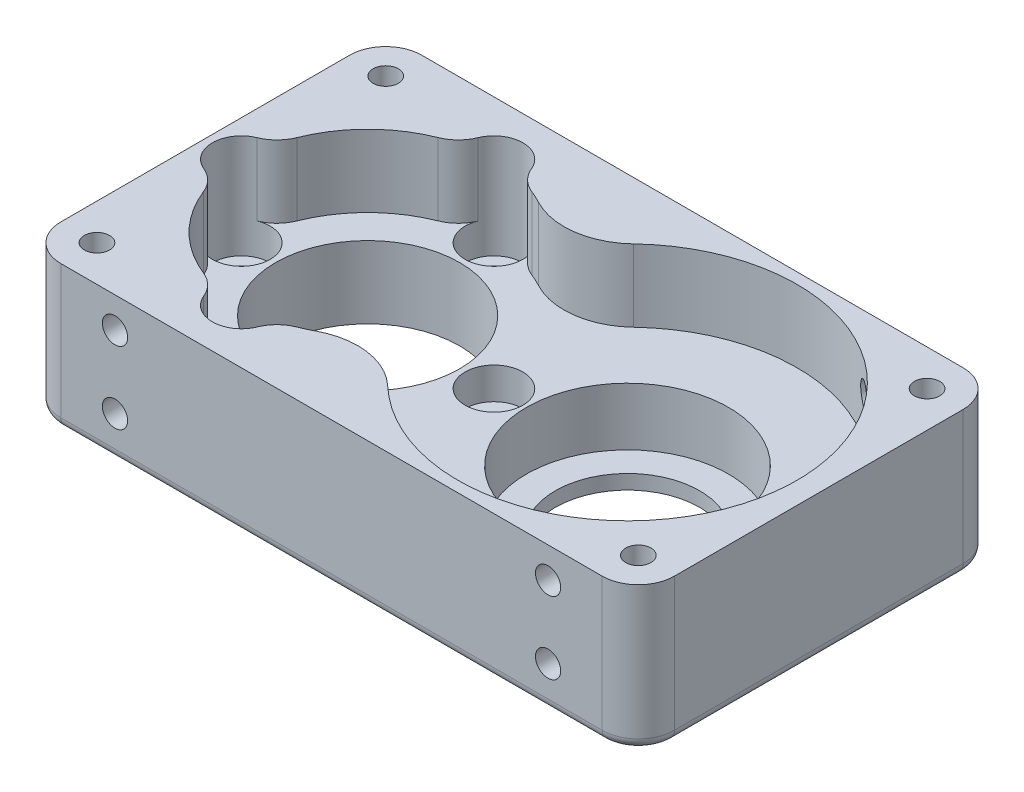
from build123d import *

# Parameters (mm, degrees)
SKETCH1_W                                           = 85
SKETCH1_H                                           = 50.00000000000001
BOSS_EXTRUDE1_DEPTH                                 = 20
CUT_EXTRUDE1_DEPTH                                  = 10
FILLET1_R                                           = 5
FILLET2_R                                           = 10
SKETCH3_R                                           = 12.75
CUT_EXTRUDE2_DEPTH                                  = 10
SKETCH13_R                                          = 3.999999999999999
SKETCH13_R_2                                        = 4.000000000000006
SKETCH13_R_3                                        = 4
CUT_EXTRUDE4_DEPTH                                  = 10
CBORE_FOR_M4_HEX_SOCKET_HEAD_CAP_SCREW2_D           = 4.5
CBORE_FOR_M4_HEX_SOCKET_HEAD_CAP_SCREW2_CBORE_D     = 8
CBORE_FOR_M4_HEX_SOCKET_HEAD_CAP_SCREW2_CBORE_DEPTH = 4.4
FILLET4_R                                           = 5
SKETCH17_R                                          = 14
CUT_EXTRUDE5_DEPTH                                  = 8
SKETCH18_R                                          = 10.000000000000002
CUT_EXTRUDE6_DEPTH                                  = 6
SKETCH19_R                                          = 1.7500000000000038
CUT_EXTRUDE7_DEPTH                                  = 12
FILLET5_R                                           = 1.5
SKETCH20_R                                          = 1.7500000000000004
SKETCH20_R_2                                        = 1.7500000000000002
SKETCH20_R_3                                        = 1.7500000000000038
SKETCH20_R_4                                        = 1.7500000000000036
CUT_EXTRUDE8_DEPTH                                  = 7


with BuildPart() as part:
    # Sketch1 → Boss-Extrude1 (new body)
    with BuildSketch(Plane(origin=(0, 0, 0), x_dir=(1, 0, 0), z_dir=(0, 1, 0))):
        Rectangle(SKETCH1_W, SKETCH1_H)
    extrude(amount=BOSS_EXTRUDE1_DEPTH)

    # Sketch2 → Cut-Extrude1 (cut)
    with BuildSketch(Plane(origin=(0, 20, 0), x_dir=(1, 0, 0), z_dir=(0, 1, 0))):
        with BuildLine():
            ThreePointArc((-5.41666666666668, 9.67348897186992), (-37.500000000000014, 2.14e-15), (-5.41666666666668, -9.67348897186992))
            ThreePointArc((-5.41666666666668, -9.67348897186992), (39.499999999999986, 0), (-5.41666666666668, 9.67348897186992))
        make_face()
    extrude(amount=-CUT_EXTRUDE1_DEPTH, mode=Mode.SUBTRACT)

    # Fillet1
    fillet1_edges = [part.edges().sort_by_distance(p)[0] for p in [
        (42.5, 10, 25),
        (-42.5, 10, 25),
        (-42.5, 10, -25),
        (42.5, 10, -25),
    ]]
    fillet(fillet1_edges, radius=FILLET1_R)

    # Fillet2
    fillet2_edges = [part.edges().sort_by_distance(p)[0] for p in [
        (-5.4166666666666785, 15, -9.673488971869928),
        (-5.416666666666677, 15, 9.673488971869919),
    ]]
    fillet(fillet2_edges, radius=FILLET2_R)

    # Sketch3 → Cut-Extrude2 (cut)
    with BuildSketch(Plane(origin=(0, 10, 0), x_dir=(1, 0, 0), z_dir=(0, 1, 0))):
        with Locations(Location((-20.00000000000001, 0, 0), (0, 0, 270))):
            Circle(SKETCH3_R)
    extrude(amount=-CUT_EXTRUDE2_DEPTH, mode=Mode.SUBTRACT)

    # Sketch13 → Cut-Extrude4 (cut)
    with BuildSketch(Plane(origin=(0, 10, 0), x_dir=(1, 0, 0), z_dir=(0, 1, 0))):
        with Locations((-20.00000000000001, 17.500000000000004)):
            Circle(SKETCH13_R)
        with Locations((-37.50000000000002, 0)):
            Circle(SKETCH13_R_2)
        with Locations((-20.00000000000001, -17.500000000000004)):
            Circle(SKETCH13_R)
        with Locations((-2.5000000000000058, 0)):
            Circle(SKETCH13_R_3)
    extrude(amount=CUT_EXTRUDE4_DEPTH, mode=Mode.SUBTRACT)

    # CBORE for M4 Hex Socket Head Cap Screw2 (through all)
    with Locations(Plane(origin=(0, 10, 0), x_dir=(1, 0, 0), z_dir=(0, 1, 0))):
        with Locations((-20, 17.5), (-37.5, 0), (-20, -17.5), (-2.5, 0)):
            CounterBoreHole(CBORE_FOR_M4_HEX_SOCKET_HEAD_CAP_SCREW2_D / 2, CBORE_FOR_M4_HEX_SOCKET_HEAD_CAP_SCREW2_CBORE_D / 2, CBORE_FOR_M4_HEX_SOCKET_HEAD_CAP_SCREW2_CBORE_DEPTH)

    # Fillet4
    # the kernel refuses this fillet: 5 mm, written as the material it takes off along each edge
    with BuildSketch(Plane(origin=(-23.973791691591714, 10, -17.042857142857144), x_dir=(-0.954076861711662, 0, 0.2995619167157709), z_dir=(0, 1, 0))) as fillet4_piece_1:
        with BuildLine():
            CenterArc((3.0036302761545866, -4.985883518062786), FILLET4_R, 94.30643699703337, 46.066169411844314)
            ThreePointArc((-0.847411708769257, -1.796921989546989), (-0.3103690050239528, -0.9519095995220337), (0, 0))
            ThreePointArc((0, 0), (1.3140882458176382, -0.04940768678026136), (2.6281764916352697, 5e-17))
        make_face()
    extrude(amount=16.570441229088175, mode=Mode.SUBTRACT)
    with BuildSketch(Plane(origin=(-16.026208308408307, 10, -17.042857142857148), x_dir=(0.9540768617116616, 0, 0.2995619167157718), z_dir=(0, 1, 0))) as fillet4_piece_2:
        with BuildLine():
            CenterArc((3.0036302761545857, 4.985883518062786), FILLET4_R, 219.62739359112237, 46.06616941184433)
            ThreePointArc((-0.8474117087692576, 1.7969219895469846), (-0.31036900502395265, 0.95190959952203), (0, 0))
            ThreePointArc((0, 0), (1.3140882458176364, 0.04940768678026209), (2.628176491635274, 4e-17))
        make_face()
    extrude(amount=16.570441229088186, mode=Mode.SUBTRACT)
    with BuildSketch(Plane(origin=(-37.04285714285715, 10, 3.973791691591705), x_dir=(0.29956191671576937, 0, 0.9540768617116623), z_dir=(0, 1, 0))) as fillet4_piece_3:
        with BuildLine():
            CenterArc((3.0036302761546088, -4.985883518062785), FILLET4_R, 94.30643699703347, 46.06616941184433)
            ThreePointArc((-0.8474117087692441, -1.7969219895469968), (-0.3103690050239449, -0.9519095995220361), (0, 0))
            ThreePointArc((0, 0), (1.3140882458176406, -0.04940768678026007), (2.628176491635283, 2e-17))
        make_face()
    extrude(amount=16.57044122908821, mode=Mode.SUBTRACT)
    with BuildSketch(Plane(origin=(-37.04285714285716, 10, -3.9737916915917033), x_dir=(-0.9907079173697112, 0, 0.13600670005911286), z_dir=(0, 1, 0))) as fillet4_piece_4:
        with BuildLine():
            CenterArc((3.2284113635675427, -4.843365499227848), FILLET4_R, 104.37926436272748, 46.066169411844285)
            ThreePointArc((-1.1210203197438697, -2.377104354862376), (-0.51582243521462, -1.2096264930292784), (0, 0))
            ThreePointArc((0, 0), (0.9933573426361664, -0.12530760061772306), (1.986714685272327, 0))
        make_face()
    extrude(amount=16.570441229088196, mode=Mode.SUBTRACT)
    with BuildSketch(Plane(origin=(-16.026208308408307, 10, 17.042857142857144), x_dir=(0.9540768617116622, 0, -0.29956191671577), z_dir=(0, 1, 0))) as fillet4_piece_5:
        with BuildLine():
            CenterArc((3.003630276154599, -4.985883518062785), FILLET4_R, 94.30643699703343, 46.06616941184434)
            ThreePointArc((-0.8474117087692495, -1.7969219895469952), (-0.31036900502395187, -0.9519095995220339), (0, 0))
            ThreePointArc((0, 0), (1.314088245817627, -0.04940768678026029), (2.6281764916352777, 1e-17))
        make_face()
    extrude(amount=16.570441229088196, mode=Mode.SUBTRACT)
    with BuildSketch(Plane(origin=(-23.97379169159171, 10, 17.042857142857144), x_dir=(0.1360067000591155, 0, 0.9907079173697108), z_dir=(0, 1, 0))) as fillet4_piece_6:
        with BuildLine():
            CenterArc((3.2284113635675378, -4.843365499227849), FILLET4_R, 104.37926436272741, 46.06616941184424)
            ThreePointArc((-1.1210203197438684, -2.37710435486237), (-0.5158224352146136, -1.2096264930292846), (0, 0))
            ThreePointArc((0, 0), (0.9933573426361628, -0.12530760061772173), (1.9867146852723276, -3e-17))
        make_face()
    extrude(amount=16.570441229088182, mode=Mode.SUBTRACT)

    # Sketch17 → Cut-Extrude5 (cut)
    with BuildSketch(Plane(origin=(0, 10, 0), x_dir=(1, 0, 0), z_dir=(0, 1, 0))):
        with Locations(Location((15.999999999999986, 0, 0), (0, 0, 270))):
            Circle(SKETCH17_R)
    extrude(amount=-CUT_EXTRUDE5_DEPTH, mode=Mode.SUBTRACT)

    # Sketch18 → Cut-Extrude6 (cut)
    with BuildSketch(Plane(origin=(0, 2, 0), x_dir=(1, 0, 0), z_dir=(0, 1, 0))):
        with Locations(Location((15.999999999999986, 0, 0), (0, 0, 270))):
            Circle(SKETCH18_R)
    extrude(amount=-CUT_EXTRUDE6_DEPTH, mode=Mode.SUBTRACT)

    # Sketch19 → Cut-Extrude7 (cut)
    with BuildSketch(Plane(origin=(0, 20, 0), x_dir=(1, 0, 0), z_dir=(0, 1, 0))):
        with Locations(Location((-37.49770482679156, 19.999999999999996, 0), (0, 0, 270))):
            Circle(SKETCH19_R)
        with Locations(Location((37.50229517320846, 20, 0), (0, 0, 270))):
            Circle(SKETCH19_R)
        with Locations(Location((37.50229517320845, -20, 0), (0, 0, 270))):
            Circle(SKETCH19_R)
        with Locations(Location((-37.49770482679156, -20, 0), (0, 0, 270))):
            Circle(SKETCH19_R)
    extrude(amount=-CUT_EXTRUDE7_DEPTH, mode=Mode.SUBTRACT)

    # Fillet5
    fillet5_edges = [part.edges().sort_by_distance(p)[0] for p in [
        (42.5, 0, 0),
        (0, 0, 25),
        (-42.5, 0, 0),
        (0, 0, -25),
        (-41.03553390593274, 0, -23.535533905932738),
        (41.03553390593274, 0, -23.535533905932738),
        (-41.03553390593274, 0, 23.535533905932738),
        (41.03553390593274, 0, 23.535533905932738),
    ]]
    fillet(fillet5_edges, radius=FILLET5_R)

    # Sketch20 → Cut-Extrude8 (cut)
    with BuildSketch(Plane.XY.offset(25)):
        with Locations((-30, 15.75)):
            Circle(SKETCH20_R)
        with Locations((-30, 5.750000000000002)):
            Circle(SKETCH20_R_2)
        with Locations((30, 15.75)):
            Circle(SKETCH20_R_3)
        with Locations((30, 5.750000000000002)):
            Circle(SKETCH20_R_4)
    cut_extrude8 = extrude(amount=-CUT_EXTRUDE8_DEPTH, mode=Mode.SUBTRACT)

    # Mirror1: Cut-Extrude8 across plane
    add(cut_extrude8.mirror(Plane.XY), mode=Mode.SUBTRACT)


solid = part.part
